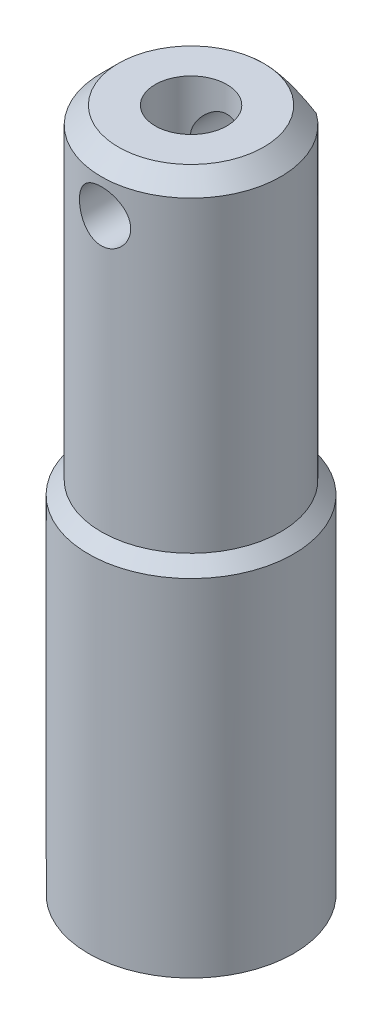
from build123d import *

# Parameters (mm, degrees)
SKETCH1_R             = 6
BOSS_EXTRUDE1_DEPTH   = 20
SKETCH2_R             = 5.25
BOSS_EXTRUDE2_DEPTH   = 20
CUT_EXTRUDE1_START    = -12
CUT_EXTRUDE1_DEPTH    = 12
M5_TAPPED_HOLE1_D     = 4.2
M5_TAPPED_HOLE1_DEPTH = 14
M5_TAPPED_HOLE1_TIP   = 1.2618073
SKETCH6_R             = 1.5
CUT_EXTRUDE2_DEPTH    = 42.72604103


with BuildPart() as part:
    # Sketch1 → Boss-Extrude1 (new body)
    with BuildSketch(Plane(origin=(0, 0, 0), x_dir=(1, 0, 0), z_dir=(0, 1, 0))):
        with Locations(Location((0, 0, 0), (0, 0, 270))):
            Circle(SKETCH1_R)
    extrude(amount=BOSS_EXTRUDE1_DEPTH)

    # Sketch2 → Boss-Extrude2 (add)
    with BuildSketch(Plane(origin=(0, 20, 0), x_dir=(1, 0, 0), z_dir=(0, 1, 0))):
        with Locations(Location((0, 0, 0), (0, 0, 270))):
            Circle(SKETCH2_R)
    extrude(amount=BOSS_EXTRUDE2_DEPTH)

    # Sketch3 → Cut-Extrude1 (cut)
    with BuildSketch(Plane(origin=(0, 40, 0), x_dir=(1, 0, 0), z_dir=(0, 1, 0)).offset(CUT_EXTRUDE1_START)):
        with BuildLine():
            Line((-3.082207001, 4.25), (3.082207001, 4.25))
            ThreePointArc((3.082207001, 4.25), (0, 5.25), (-3.082207001, 4.25))
        make_face()
    extrude(amount=CUT_EXTRUDE1_DEPTH, mode=Mode.SUBTRACT)

    # M5 Tapped Hole1
    with Locations(Plane(origin=(0, 40, 0), x_dir=(1, 0, 0), z_dir=(0, 1, 0))):
        with Locations((0, 0)):
            Hole(M5_TAPPED_HOLE1_D / 2, depth=M5_TAPPED_HOLE1_DEPTH)
            with Locations((0, 0, -(M5_TAPPED_HOLE1_DEPTH + M5_TAPPED_HOLE1_TIP / 2))):  # 118° drill point
                Cone(0, M5_TAPPED_HOLE1_D / 2, M5_TAPPED_HOLE1_TIP, mode=Mode.SUBTRACT)

    # Sketch6 → Cut-Extrude2 (cut, through all)
    with BuildSketch(Plane(origin=(0, 0, -4.25), x_dir=(-1, 0, 0), z_dir=(0, 0, -1))):
        with Locations((0, 37)):
            Circle(SKETCH6_R)
    extrude(amount=-CUT_EXTRUDE2_DEPTH, mode=Mode.SUBTRACT)

    # Chamfer1
    # the kernel refuses this chamfer: 1 mm, written as the material it adds along each edge
    with BuildSketch(Plane(origin=(0, 20, 0), x_dir=(0, 0, 1), z_dir=(-1, 0, 0))) as chamfer1_piece_1_section:
        with BuildLine():
            Line((6.278284271, -0.028284271), (5.221715729, 1.028284271))
            Line((5.221715729, 1.028284271), (5.201715729, 1.028284271))
            ThreePointArc((5.201715729, 1.028284271), (5.23, 0.514142136), (5.23, 0))
            Line((5.23, 0), (5.25, -0.02))
            ThreePointArc((5.25, -0.02), (5.764142136, -0.02), (6.278284271, -0.048284271))
            Line((6.278284271, -0.048284271), (6.278284271, -0.028284271))
        make_face()
    chamfer1_piece_1 = revolve(axis=Axis((0, 20, 0), (0, 1, 0)), mode=Mode.PRIVATE)
    chamfer1_piece_1 = chamfer1_piece_1 & Plane(origin=(0, 20.620713895, 0), x_dir=(0, 0, 1), z_dir=(0, -1, 0)) * Cylinder(6, 26, mode=Mode.PRIVATE)
    add(chamfer1_piece_1)
    # the kernel refuses this chamfer: 1 mm, written as the material it takes off along each edge
    with BuildSketch(Plane(origin=(0, 40, 0), x_dir=(0.522159484326456, 0, -0.8528478603642795), z_dir=(0.8528478603642795, 0, 0.522159484326456))) as chamfer1_2_piece_1:
        with BuildLine():
            Line((5.278284271, -1.028284271), (4.221715729, 0.028284271))
            Line((4.221715729, 0.028284271), (4.221715729, 0.048284271))
            ThreePointArc((4.221715729, 0.048284271), (4.735857864, 0.02), (5.25, 0.02))
            Line((5.25, 0.02), (5.27, 0))
            ThreePointArc((5.27, 0), (5.27, -0.514142136), (5.298284271, -1.028284271))
            Line((5.298284271, -1.028284271), (5.278284271, -1.028284271))
        make_face()
    revolve(axis=Axis((0, 40, 0), (0, 1, 0)), revolution_arc=211.477217225, mode=Mode.SUBTRACT)
    with BuildSketch(Plane(origin=(0, 40, 0), x_dir=(0, 0, 1), z_dir=(-1, 0, 0))) as chamfer1_2_piece_2:
        with BuildLine():
            Line((5.278284271, -1.028284271), (4.221715729, 0.028284271))
            Line((4.221715729, 0.028284271), (4.221715729, 0.048284271))
            ThreePointArc((4.221715729, 0.048284271), (4.735857864, 0.02), (5.25, 0.02))
            Line((5.25, 0.02), (5.27, 0))
            ThreePointArc((5.27, 0), (5.27, -0.514142136), (5.298284271, -1.028284271))
            Line((5.298284271, -1.028284271), (5.278284271, -1.028284271))
        make_face()
    revolve(axis=Axis((0, 40, 0), (0, 1, 0)), revolution_arc=211.477217225, mode=Mode.SUBTRACT)


solid = part.part
